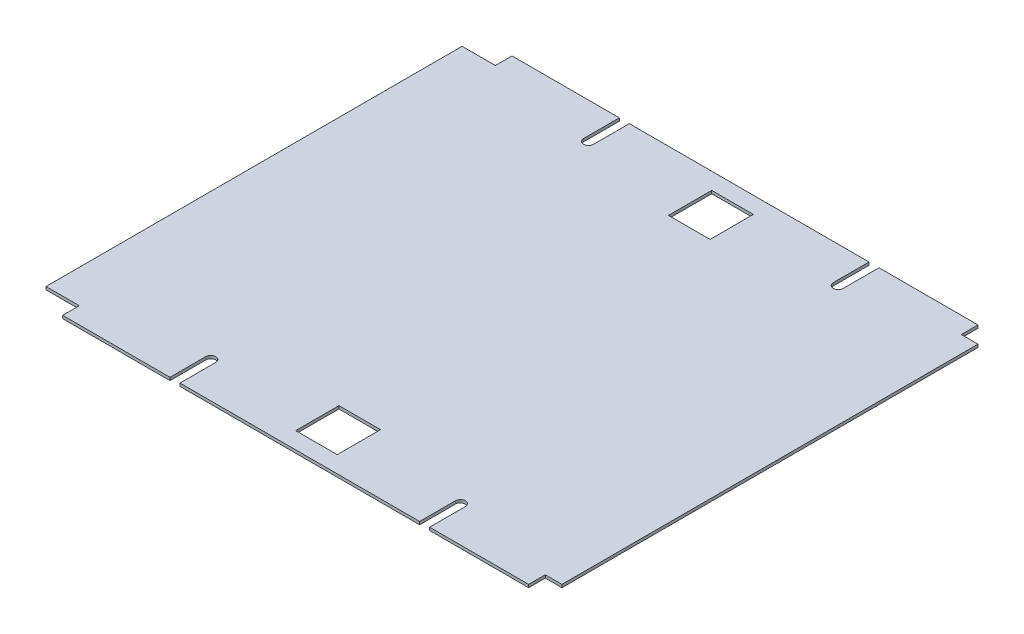
from build123d import *

# Parameters (mm, degrees)
BOSS_EXTRUDE1_DEPTH = 3.5
SKETCH2_W           = 50
SKETCH2_H           = 52
SKETCH2_W_2         = 20
SKETCH2_H_2         = 40
CUT_EXTRUDE1_DEPTH  = 10
CUT_EXTRUDE2_DEPTH  = 10
SKETCH4_W           = 20
SKETCH4_H           = 420
CUT_EXTRUDE3_DEPTH  = 419.70305707


with BuildPart() as part:
    # Sketch1 → Boss-Extrude1 (new body)
    with BuildSketch(Plane(origin=(0, 0, 0), x_dir=(1, 0, 0), z_dir=(0, 1, 0))):
        Polygon((-280, 270), (280, 270), (280, 250), (320, 250), (320, -250), (280, -250), (280, -270), (-280, -270), (-280, -250), (-320, -250), (-320, 250), (-280, 250), align=None)
    extrude(amount=BOSS_EXTRUDE1_DEPTH)

    # Sketch2 → Cut-Extrude1 (cut)
    with BuildSketch(Plane(origin=(0, 3.5, 0), x_dir=(1, 0, 0), z_dir=(0, 1, 0))):
        with Locations((5, -224)):
            Rectangle(SKETCH2_W, SKETCH2_H)
        with Locations((5, 224)):
            Rectangle(SKETCH2_W, SKETCH2_H)
        with Locations((310, 230)):
            Rectangle(SKETCH2_W_2, SKETCH2_H_2)
        with Locations((310, -230)):
            Rectangle(SKETCH2_W_2, SKETCH2_H_2)
    extrude(amount=-CUT_EXTRUDE1_DEPTH, mode=Mode.SUBTRACT)

    # Sketch3 → Cut-Extrude2 (cut)
    with BuildSketch(Plane(origin=(0, 3.5, 0), x_dir=(1, 0, 0), z_dir=(0, 1, 0))):
        with BuildLine():
            Line((149, 227), (149, 270))
            Line((149, 270), (161, 270))
            Line((161, 270), (161, 227))
            ThreePointArc((161, 227), (155, 221), (149, 227))
        make_face()
        with BuildLine():
            Line((161, -227), (161, -270))
            Line((161, -270), (149, -270))
            Line((149, -270), (149, -227))
            ThreePointArc((149, -227), (155, -221), (161, -227))
        make_face()
        with BuildLine():
            Line((-139, -227), (-139, -270))
            Line((-139, -270), (-151, -270))
            Line((-151, -270), (-151, -227))
            ThreePointArc((-151, -227), (-145, -221), (-139, -227))
        make_face()
        with BuildLine():
            Line((-151, 227), (-151, 270))
            Line((-151, 270), (-139, 270))
            Line((-139, 270), (-139, 227))
            ThreePointArc((-139, 227), (-145, 221), (-151, 227))
        make_face()
    extrude(amount=-CUT_EXTRUDE2_DEPTH, mode=Mode.SUBTRACT)

    # Sketch4 → Cut-Extrude3 (cut, through all)
    with BuildSketch(Plane(origin=(0, 3.5, 0), x_dir=(1, 0, 0), z_dir=(0, 1, 0))):
        with Locations((310, 0)):
            Rectangle(SKETCH4_W, SKETCH4_H)
    extrude(amount=-CUT_EXTRUDE3_DEPTH, mode=Mode.SUBTRACT)


solid = part.part
